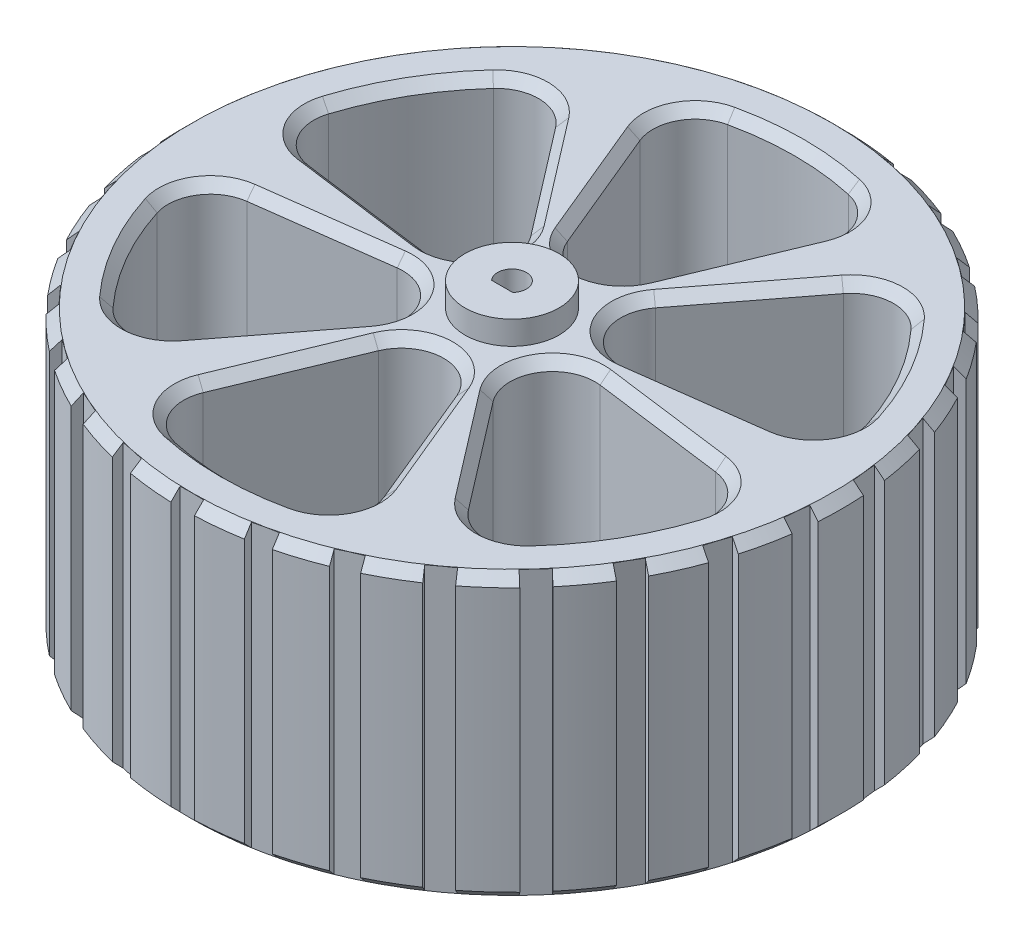
from build123d import *

# Parameters (mm, degrees)
SKETCH1_R                      = 35
BOSS_EXTRUDE1_DEPTH            = 30
SKETCH2_W                      = 2.5
SKETCH2_H                      = 2
CUT_EXTRUDE2_DEPTH             = 30
BOSS_EXTRUDE2_DEPTH            = 10
BOSS_EXTRUDE2_DEPTH_BACK       = 32.5
SKETCH3_R                      = 5
CUT_EXTRUDE3_DEPTH             = 66.227965628
CUT_EXTRUDE3_DEPTH_BACK        = 66.227965628
CUT_EXTRUDE4_REACH             = 61.822
CUT_EXTRUDE4_END_RADIUS        = 5
SKETCH5_R                      = 2.491435
CUT_EXTRUDE4_DIRECTION_2_DEPTH = 2.571835
CHAMFER2_SIZE                  = 1


with BuildPart() as part:
    # Sketch1 → Boss-Extrude1 (new body)
    with BuildSketch(Plane(origin=(0, 0, 0), x_dir=(1, 0, 0), z_dir=(0, 1, 0))):
        with Locations(Location((0, 0, 0), (0, 0, 270))):
            Circle(SKETCH1_R)
        with BuildLine():
            Line((-4.157457896, 10.036991238), (-9.60527792, 23.189192226))
            ThreePointArc((-9.60527792, 23.189192226), (-9.436386382, 26.994855539), (-6.409200028, 29.307373731))
            ThreePointArc((-6.409200028, 29.307373731), (0, 30), (6.409200028, 29.307373731))
            ThreePointArc((6.409200028, 29.307373731), (9.436386382, 26.994855539), (9.60527792, 23.189192226))
            Line((9.60527792, 23.189192226), (4.157457896, 10.036991238))
            ThreePointArc((4.157457896, 10.036991238), (0, 7.259066684), (-4.157457896, 10.036991238))
        make_face(mode=Mode.SUBTRACT)
        with BuildLine():
            Line((6.613560442, 8.618959772), (15.2797906, 19.913010802))
            ThreePointArc((15.2797906, 19.913010802), (18.660037477, 21.669578097), (22.176330155, 20.204216908))
            ThreePointArc((22.176330155, 20.204216908), (25.980762114, 15), (28.585530183, 9.103156823))
            ThreePointArc((28.585530183, 9.103156823), (28.09642386, 5.325277443), (24.885068521, 3.276181423))
            Line((24.885068521, 3.276181423), (10.771018338, 1.418031466))
            ThreePointArc((10.771018338, 1.418031466), (6.286536156, 3.629533342), (6.613560442, 8.618959772))
        make_face(mode=Mode.SUBTRACT)
        with BuildLine():
            Line((10.771018338, -1.418031466), (24.885068521, -3.276181423))
            ThreePointArc((24.885068521, -3.276181423), (28.09642386, -5.325277443), (28.585530183, -9.103156823))
            ThreePointArc((28.585530183, -9.103156823), (25.980762114, -15), (22.176330155, -20.204216908))
            ThreePointArc((22.176330155, -20.204216908), (18.660037477, -21.669578097), (15.2797906, -19.913010802))
            Line((15.2797906, -19.913010802), (6.613560442, -8.618959772))
            ThreePointArc((6.613560442, -8.618959772), (6.286536156, -3.629533342), (10.771018338, -1.418031466))
        make_face(mode=Mode.SUBTRACT)
        with BuildLine():
            Line((4.157457896, -10.036991238), (9.60527792, -23.189192226))
            ThreePointArc((9.60527792, -23.189192226), (9.436386382, -26.994855539), (6.409200028, -29.307373731))
            ThreePointArc((6.409200028, -29.307373731), (0, -30), (-6.409200028, -29.307373731))
            ThreePointArc((-6.409200028, -29.307373731), (-9.436386382, -26.994855539), (-9.60527792, -23.189192226))
            Line((-9.60527792, -23.189192226), (-4.157457896, -10.036991238))
            ThreePointArc((-4.157457896, -10.036991238), (0, -7.259066684), (4.157457896, -10.036991238))
        make_face(mode=Mode.SUBTRACT)
        with BuildLine():
            Line((-6.613560442, -8.618959772), (-15.2797906, -19.913010802))
            ThreePointArc((-15.2797906, -19.913010802), (-18.660037477, -21.669578097), (-22.176330155, -20.204216908))
            ThreePointArc((-22.176330155, -20.204216908), (-25.980762114, -15), (-28.585530183, -9.103156823))
            ThreePointArc((-28.585530183, -9.103156823), (-28.09642386, -5.325277443), (-24.885068521, -3.276181423))
            Line((-24.885068521, -3.276181423), (-10.771018338, -1.418031466))
            ThreePointArc((-10.771018338, -1.418031466), (-6.286536156, -3.629533342), (-6.613560442, -8.618959772))
        make_face(mode=Mode.SUBTRACT)
        with BuildLine():
            Line((-10.771018338, 1.418031466), (-24.885068521, 3.276181423))
            ThreePointArc((-24.885068521, 3.276181423), (-28.09642386, 5.325277443), (-28.585530183, 9.103156823))
            ThreePointArc((-28.585530183, 9.103156823), (-25.980762114, 15), (-22.176330155, 20.204216908))
            ThreePointArc((-22.176330155, 20.204216908), (-18.660037477, 21.669578097), (-15.2797906, 19.913010802))
            Line((-15.2797906, 19.913010802), (-6.613560442, 8.618959772))
            ThreePointArc((-6.613560442, 8.618959772), (-6.286536156, 3.629533342), (-10.771018338, 1.418031466))
        make_face(mode=Mode.SUBTRACT)
    extrude(amount=BOSS_EXTRUDE1_DEPTH)

    # Sketch2 → Cut-Extrude2 (cut)
    with BuildSketch(Plane.XZ):
        Polygon((8.70750537, 34.953424013), (8.291681989, 32.997128811), (5.846312987, 33.516908038), (6.262136369, 35.47320324), align=None)
        with Locations((0, 35)):
            Rectangle(SKETCH2_W, SKETCH2_H)
        Polygon((15.784450973, 32.379215671), (14.970977687, 30.552124756), (12.687114043, 31.568966364), (13.500587329, 33.396057279), align=None)
        Polygon((22.171540325, 28.389880232), (20.995969821, 26.771846243), (18.973427335, 28.241309374), (20.14899784, 29.859343363), align=None)
        Polygon((27.589626975, 23.159770797), (26.103337324, 21.821509584), (24.430510808, 23.679371648), (25.916800459, 25.017632861), align=None)
        Polygon((31.801914536, 16.917468245), (30.069863729, 15.917468245), (28.819863729, 18.082531755), (30.551914536, 19.082531755), align=None)
        Polygon((34.62430583, 9.935791152), (32.722192797, 9.317757163), (31.949650311, 11.695398454), (33.851763344, 12.313432443), align=None)
        Polygon((35.933448812, 2.519872308), (33.944405022, 2.310815382), (33.683083863, 4.79712012), (35.672127654, 5.006177047), align=None)
        Polygon((35.672127654, -5.006177047), (33.683083863, -4.79712012), (33.944405022, -2.310815382), (35.933448812, -2.519872308), align=None)
        Polygon((33.851763344, -12.313432443), (31.949650311, -11.695398454), (32.722192797, -9.317757163), (34.62430583, -9.935791152), align=None)
        Polygon((30.551914536, -19.082531755), (28.819863729, -18.082531755), (30.069863729, -15.917468245), (31.801914536, -16.917468245), align=None)
        Polygon((25.916800459, -25.017632861), (24.430510808, -23.679371648), (26.103337324, -21.821509584), (27.589626975, -23.159770797), align=None)
        Polygon((20.14899784, -29.859343363), (18.973427335, -28.241309374), (20.995969821, -26.771846243), (22.171540325, -28.389880232), align=None)
        Polygon((13.500587329, -33.396057279), (12.687114043, -31.568966364), (14.970977687, -30.552124756), (15.784450973, -32.379215671), align=None)
        Polygon((6.262136369, -35.47320324), (5.846312987, -33.516908038), (8.291681989, -32.997128811), (8.70750537, -34.953424013), align=None)
        with Locations((0, -35)):
            Rectangle(SKETCH2_W, SKETCH2_H)
        Polygon((-8.70750537, -34.953424013), (-8.291681989, -32.997128811), (-5.846312987, -33.516908038), (-6.262136369, -35.47320324), align=None)
        Polygon((-15.784450973, -32.379215671), (-14.970977687, -30.552124756), (-12.687114043, -31.568966364), (-13.500587329, -33.396057279), align=None)
        Polygon((-22.171540325, -28.389880232), (-20.995969821, -26.771846243), (-18.973427335, -28.241309374), (-20.14899784, -29.859343363), align=None)
        Polygon((-27.589626975, -23.159770797), (-26.103337324, -21.821509584), (-24.430510808, -23.679371648), (-25.916800459, -25.017632861), align=None)
        Polygon((-31.801914536, -16.917468245), (-30.069863729, -15.917468245), (-28.819863729, -18.082531755), (-30.551914536, -19.082531755), align=None)
        Polygon((-34.62430583, -9.935791152), (-32.722192797, -9.317757163), (-31.949650311, -11.695398454), (-33.851763344, -12.313432443), align=None)
        Polygon((-35.933448812, -2.519872308), (-33.944405022, -2.310815382), (-33.683083863, -4.79712012), (-35.672127654, -5.006177047), align=None)
        Polygon((-35.672127654, 5.006177047), (-33.683083863, 4.79712012), (-33.944405022, 2.310815382), (-35.933448812, 2.519872308), align=None)
        Polygon((-33.851763344, 12.313432443), (-31.949650311, 11.695398454), (-32.722192797, 9.317757163), (-34.62430583, 9.935791152), align=None)
        Polygon((-30.551914536, 19.082531755), (-28.819863729, 18.082531755), (-30.069863729, 15.917468245), (-31.801914536, 16.917468245), align=None)
        Polygon((-25.916800459, 25.017632861), (-24.430510808, 23.679371648), (-26.103337324, 21.821509584), (-27.589626975, 23.159770797), align=None)
        Polygon((-20.14899784, 29.859343363), (-18.973427335, 28.241309374), (-20.995969821, 26.771846243), (-22.171540325, 28.389880232), align=None)
        Polygon((-13.500587329, 33.396057279), (-12.687114043, 31.568966364), (-14.970977687, 30.552124756), (-15.784450973, 32.379215671), align=None)
        Polygon((-6.262136369, 35.47320324), (-5.846312987, 33.516908038), (-8.291681989, 32.997128811), (-8.70750537, 34.953424013), align=None)
    extrude(amount=-CUT_EXTRUDE2_DEPTH, mode=Mode.SUBTRACT)

    # Sketch3 → Boss-Extrude2 (add, two sides: drawn at the far end of the back side and taken through both)
    with BuildSketch(Plane.XZ.offset(-BOSS_EXTRUDE2_DEPTH_BACK)):
        with Locations(Location((0, 0, 0), (0, 0, 270))):
            Circle(SKETCH3_R)
    extrude(amount=BOSS_EXTRUDE2_DEPTH + BOSS_EXTRUDE2_DEPTH_BACK)

    # Sketch4 → Cut-Extrude3 (cut, two sides: drawn at the far end of the back side and taken through both)
    with BuildSketch(Plane.XZ.offset(10).offset(-CUT_EXTRUDE3_DEPTH_BACK)):
        with BuildLine():
            Line((-1.12, 1.042044838), (1.12, 1.042044838))
            ThreePointArc((1.12, 1.042044838), (0, -1.52979), (-1.12, 1.042044838))
        make_face()
    extrude(amount=CUT_EXTRUDE3_DEPTH + CUT_EXTRUDE3_DEPTH_BACK, mode=Mode.SUBTRACT)

    # Cut-Extrude4: up to this cylinder (the profile starts inside it)
    cut_extrude4_end = Plane(origin=(0, -5, 0), z_dir=(0, -1, 0)) * Cylinder(CUT_EXTRUDE4_END_RADIUS, 134.644, mode=Mode.PRIVATE)
    # Sketch5 → Cut-Extrude4 (cut, up to the surface)
    with BuildSketch(Plane(origin=(0, 0, 1.042044838), x_dir=(-1, 0, 0), z_dir=(0, 0, -1)), mode=Mode.PRIVATE) as cut_extrude4_sk1:
        with Locations(Location((0, -5, 0), (0, 0, 180))):
            Circle(SKETCH5_R)
    cut_extrude4_tool1 = extrude(cut_extrude4_sk1.sketch, amount=-CUT_EXTRUDE4_REACH, mode=Mode.PRIVATE) & cut_extrude4_end
    add(cut_extrude4_tool1.solids().sort_by_distance((0, -5, 1.042045))[0], mode=Mode.SUBTRACT)

    # Sketch5 → Cut-Extrude4 direction 2 (cut)
    with BuildSketch(Plane(origin=(0, 0, 1.042044838), x_dir=(-1, 0, 0), z_dir=(0, 0, -1))):
        with Locations(Location((0, -5, 0), (0, 0, 180))):
            Circle(SKETCH5_R)
    extrude(amount=CUT_EXTRUDE4_DIRECTION_2_DEPTH, mode=Mode.SUBTRACT)

    # Chamfer2
    chamfer2_edges = [part.edges().sort_by_distance(p)[0] for p in [
        (-6.286536156, 0, -3.629533342),
        (-10.946675521, 0, -14.265985287),
        (-18.660037477, 0, -21.669578097),
        (-25.980762114, 0, -15),
        (-28.09642386, 0, -5.325277443),
        (-17.828043429, 0, -2.347106445),
        (-6.286536156, 30, -3.629533342),
        (-10.946675521, 30, -14.265985287),
        (-18.660037477, 30, -21.669578097),
        (-25.980762114, 30, -15),
        (-28.09642386, 30, -5.325277443),
        (-17.828043429, 30, -2.347106445),
        (-6.286536156, 0, 3.629533342),
        (-17.828043429, 0, 2.347106445),
        (-28.09642386, 0, 5.325277443),
        (-25.980762114, 0, 15),
        (-18.660037477, 0, 21.669578097),
        (-10.946675521, 0, 14.265985287),
        (-6.286536156, 30, 3.629533342),
        (-17.828043429, 30, 2.347106445),
        (-28.09642386, 30, 5.325277443),
        (-25.980762114, 30, 15),
        (-18.660037477, 30, 21.669578097),
        (-10.946675521, 30, 14.265985287),
        (0, 0, 7.259066684),
        (-6.881367908, 0, 16.613091732),
        (-9.436386382, 0, 26.994855539),
        (0, 0, 30),
        (9.436386382, 0, 26.994855539),
        (6.881367908, 0, 16.613091732),
        (0, 30, 7.259066684),
        (-6.881367908, 30, 16.613091732),
        (-9.436386382, 30, 26.994855539),
        (0, 30, 30),
        (9.436386382, 30, 26.994855539),
        (6.881367908, 30, 16.613091732),
        (6.286536156, 0, 3.629533342),
        (10.946675521, 0, 14.265985287),
        (18.660037477, 0, 21.669578097),
        (25.980762114, 0, 15),
        (28.09642386, 0, 5.325277443),
        (17.828043429, 0, 2.347106445),
        (6.286536156, 30, 3.629533342),
        (10.946675521, 30, 14.265985287),
        (18.660037477, 30, 21.669578097),
        (25.980762114, 30, 15),
        (28.09642386, 30, 5.325277443),
        (17.828043429, 30, 2.347106445),
        (6.286536156, 0, -3.629533342),
        (17.828043429, 0, -2.347106445),
        (28.09642386, 0, -5.325277443),
        (25.980762114, 0, -15),
        (18.660037477, 0, -21.669578097),
        (10.946675521, 0, -14.265985287),
        (6.286536156, 30, -3.629533342),
        (17.828043429, 30, -2.347106445),
        (28.09642386, 30, -5.325277443),
        (25.980762114, 30, -15),
        (18.660037477, 30, -21.669578097),
        (10.946675521, 30, -14.265985287),
        (0, 0, -7.259066684),
        (6.881367908, 0, -16.613091732),
        (9.436386382, 0, -26.994855539),
        (0, 0, -30),
        (-9.436386382, 0, -26.994855539),
        (-6.881367908, 0, -16.613091732),
        (0, 30, -7.259066684),
        (6.881367908, 30, -16.613091732),
        (9.436386382, 30, -26.994855539),
        (0, 30, -30),
        (-9.436386382, 30, -26.994855539),
        (-6.881367908, 30, -16.613091732),
        (-3.658496214, 0, 34.808266338),
        (-10.815594803, 0, 33.28697807),
        (-17.5, 0, 30.310889132),
        (-23.419571223, 0, 26.010068892),
        (-28.315594803, 0, 20.57248383),
        (-31.974091017, 0, 14.235782508),
        (-34.235166026, 0, 7.276909179),
        (-35, 0, 0),
        (-34.235166026, 0, -7.276909179),
        (-31.974091017, 0, -14.235782508),
        (-28.315594803, 0, -20.57248383),
        (-23.419571223, 0, -26.010068892),
        (-17.5, 0, -30.310889132),
        (-10.815594803, 0, -33.28697807),
        (-3.658496214, 0, -34.808266338),
        (3.658496214, 0, -34.808266338),
        (10.815594803, 0, -33.28697807),
        (17.5, 0, -30.310889132),
        (23.419571223, 0, -26.010068892),
        (28.315594803, 0, -20.57248383),
        (31.974091017, 0, -14.235782508),
        (34.235166026, 0, -7.276909179),
        (35, 0, 0),
        (34.235166026, 0, 7.276909179),
        (31.974091017, 0, 14.235782508),
        (28.315594803, 0, 20.57248383),
        (17.5, 0, 30.310889132),
        (10.815594803, 0, 33.28697807),
        (3.658496214, 0, 34.808266338),
        (-3.658496214, 30, 34.808266338),
        (-10.815594803, 30, 33.28697807),
        (-17.5, 30, 30.310889132),
        (-23.419571223, 30, 26.010068892),
        (-28.315594803, 30, 20.57248383),
        (-31.974091017, 30, 14.235782508),
        (-34.235166026, 30, 7.276909179),
        (-35, 30, 0),
        (-34.235166026, 30, -7.276909179),
        (-31.974091017, 30, -14.235782508),
        (-28.315594803, 30, -20.57248383),
        (-23.419571223, 30, -26.010068892),
        (-17.5, 30, -30.310889132),
        (-10.815594803, 30, -33.28697807),
        (-3.658496214, 30, -34.808266338),
        (3.658496214, 30, -34.808266338),
        (10.815594803, 30, -33.28697807),
        (17.5, 30, -30.310889132),
        (23.419571223, 30, -26.010068892),
        (28.315594803, 30, -20.57248383),
        (31.974091017, 30, -14.235782508),
        (34.235166026, 30, -7.276909179),
        (35, 30, 0),
        (34.235166026, 30, 7.276909179),
        (31.974091017, 30, 14.235782508),
        (28.315594803, 30, 20.57248383),
        (23.419571223, 30, 26.010068892),
        (17.5, 30, 30.310889132),
        (10.815594803, 30, 33.28697807),
        (3.658496214, 30, 34.808266338),
        (23.419571223, 0, 26.010068892),
    ]]
    chamfer(chamfer2_edges, length=CHAMFER2_SIZE - 0.0001)  # a hair under: the kernel refuses the full size


solid = part.part
